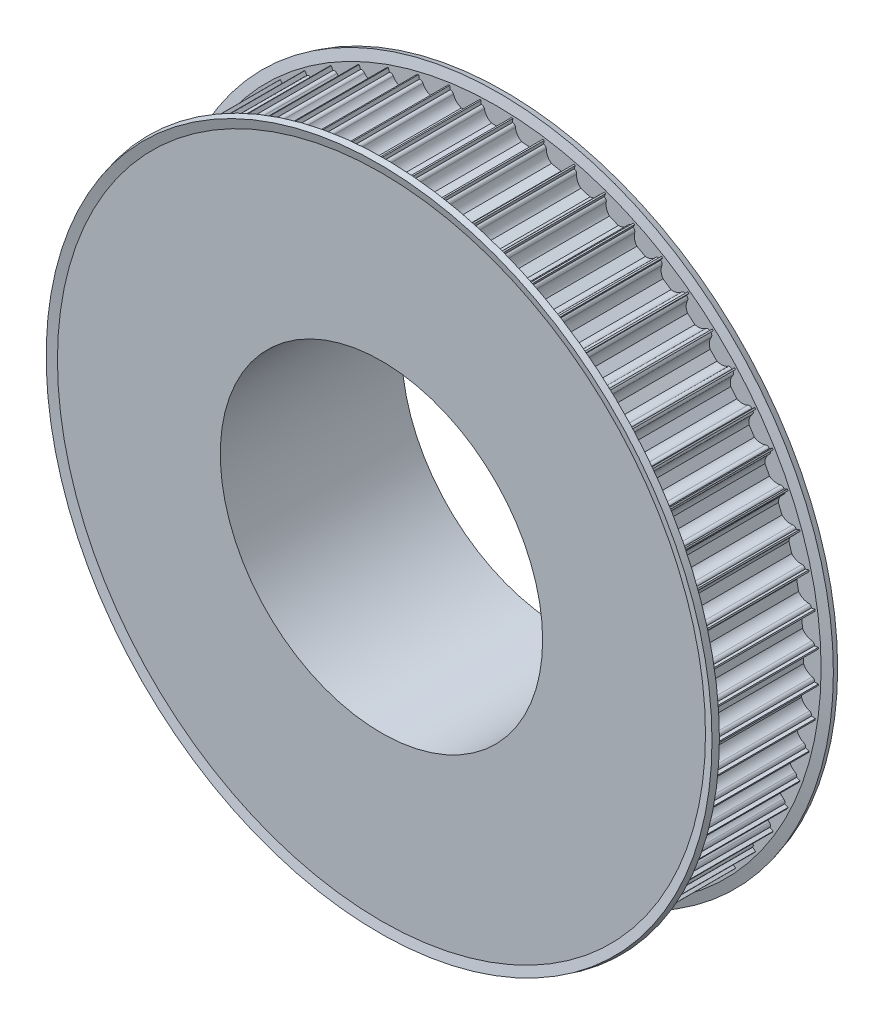
from build123d import *

# Parameters (mm, degrees)
CUT_EXTRUDE1_REACH = 123.758
CIRPATTERN1_COUNT  = 64


with BuildPart() as part:
    # Sketch1 → Revolve1 (revolve)
    with BuildSketch(Plane(origin=(0, 0, 0), x_dir=(0, 0, -1), z_dir=(1, 0, 0))):
        Polygon((0, 40), (45, 40), (45, 55.5), (30, 55.5), (30, 80), (0, 80), align=None)
    revolve(axis=Axis((0, 0, 0), (0, 0, -1)))

    # Sketch2 → Cut-Extrude1 (cut, up to next)
    with BuildSketch(Plane.XY, mode=Mode.PRIVATE) as cut_extrude1_sk1:
        with BuildLine():
            Line((-3.674234614, 79), (-3.75, 79))
            Line((-3.75, 79), (-3.75, 81))
            Line((-3.75, 81), (3.75, 81))
            Line((3.75, 81), (3.75, 79))
            Line((3.75, 79), (3.674234614, 79))
            ThreePointArc((3.674234614, 79), (3.199892965, 78.830947502), (2.939387691, 78.4))
            ThreePointArc((2.939387691, 78.4), (2.331759211, 77.112435701), (1.198957881, 76.25))
            Line((1.198957881, 76.25), (-1.198957881, 76.25))
            ThreePointArc((-1.198957881, 76.25), (-2.331759211, 77.112435701), (-2.939387691, 78.4))
            ThreePointArc((-2.939387691, 78.4), (-3.199892965, 78.830947502), (-3.674234614, 79))
        make_face()
    cut_extrude1_tool1 = extrude(cut_extrude1_sk1.sketch, amount=-CUT_EXTRUDE1_REACH, mode=Mode.PRIVATE) & part.part
    cut_extrude1 = cut_extrude1_tool1.solids().sort_by_distance((0, 78.935169, 0))[0]
    add(cut_extrude1, mode=Mode.SUBTRACT)

    # CirPattern1: Cut-Extrude1 ×64 about axis
    cirpattern1_axis = Axis((0, 0, 0), (0, 0, 1))
    for i in range(1, CIRPATTERN1_COUNT):
        add(cut_extrude1.rotate(cirpattern1_axis, i * 360 / CIRPATTERN1_COUNT), mode=Mode.SUBTRACT)

    # Sketch3 → Revolve2 (revolve)
    with BuildSketch(Plane(origin=(0, 0, 0), x_dir=(0, 0, -1), z_dir=(1, 0, 0))):
        Polygon((30, 55.5), (30, 80.412521254), (30.591966801, 82.621771432), (29.143078062, 83.01), (28.5, 80.61), (28.5, 55.5), align=None)
        Polygon((1.5, 80.61), (1.5, 55.5), (0, 55.5), (0, 80.412521254), (-0.591966801, 82.621771432), (0.856921938, 83.01), align=None)
    revolve(axis=Axis((0, 0, 85.541686688), (0, 0, -1)))


solid = part.part
